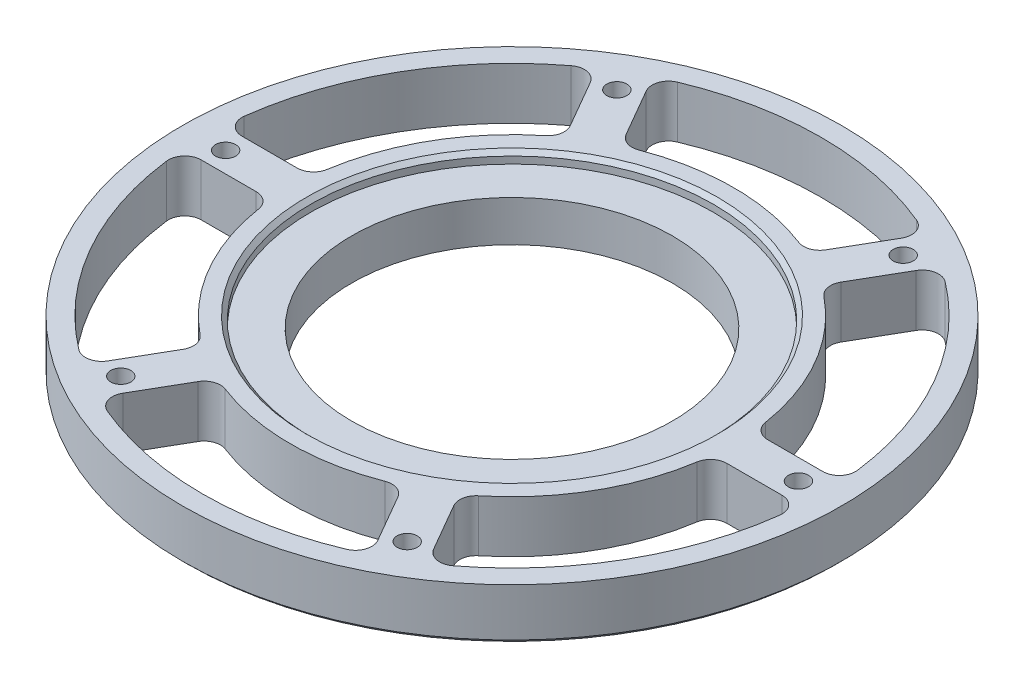
from build123d import *

# Parameters (mm, degrees)
F_10_0_1935_DIAMETER_HOLE1_D = 4.9149
CIRPATTERN3_COUNT            = 6
CUT_EXTRUDE1_DEPTH           = 115.6206569515286
FILLET1_R                    = 4
CIRPATTERN4_COUNT            = 6
FILLET1_OF_CIRPATTERN4_R     = 4
CHAMFER1_SIZE                = 1
CHAMFER2_SIZE                = 1


with BuildPart() as part:
    # Sketch2 → Revolve1 (revolve)
    with BuildSketch(Plane(origin=(0, 0, 0), x_dir=(0, 0, -1), z_dir=(1, 0, 0))):
        Polygon((-39.2125, -8.7e-16), (-80.55, -5.06e-15), (-80.55, 12.699999999999994), (-49.2125, 12.699999999999994), (-49.21250000000001, 9.999999999999998), (-39.21250000000001, 9.999999999999998), align=None)
    revolve(axis=Axis((0, -0.6350000000000053, 0), (0, 1, 0)))

    # #10 (0.1935) Diameter Hole1 (through all)
    with Locations(Plane(origin=(0, 12.699999999999994, 0), x_dir=(1, 0, 0), z_dir=(0, 1, 0))):
        with Locations((-35, 60.621778265)):
            f_10_0_1935_diameter_hole1 = Hole(F_10_0_1935_DIAMETER_HOLE1_D / 2)

    # CirPattern3: #10 (0.1935) Diameter Hole1 ×6 about axis
    cirpattern3_axis = Axis((0, -0.6350000000000053, 0), (0, 1, 0))
    for i in range(1, CIRPATTERN3_COUNT):
        add(f_10_0_1935_diameter_hole1.rotate(cirpattern3_axis, i * 360 / CIRPATTERN3_COUNT), mode=Mode.SUBTRACT)

    # Sketch8 → Cut-Extrude1 (cut, through all)
    with BuildSketch(Plane(origin=(0, 12.699999999999994, 0), x_dir=(1, 0, 0), z_dir=(0, 1, 0))):
        with BuildLine():
            Line((-33.36205552600358, 67.78477521597199), (-22.660589701137393, 49.249292691841845))
            ThreePointArc((-22.660589701137393, 49.249292691841845), (3.32e-15, 54.212500000000006), (22.660589701137393, 49.249292691841845))
            Line((22.660589701137393, 49.249292691841845), (33.36205552600358, 67.78477521597199))
            ThreePointArc((33.36205552600358, 67.78477521597199), (4.63e-15, 75.54999999999998), (-33.36205552600358, 67.78477521597199))
        make_face()
    cut_extrude1 = extrude(amount=-CUT_EXTRUDE1_DEPTH, mode=Mode.SUBTRACT)

    # Fillet1
    fillet1_edges = [part.edges().sort_by_distance(p)[0] for p in [
        (33.36205552600358, 6.349999999999996, -67.78477521597199),
        (22.660589701137397, 6.349999999999996, -49.249292691841845),
        (-33.36205552600357, 6.349999999999996, -67.78477521597199),
        (-22.660589701137393, 6.349999999999996, -49.249292691841845),
    ]]
    fillet(fillet1_edges, radius=FILLET1_R)

    # CirPattern4: Cut-Extrude1 ×6 about axis
    cirpattern4_axis = Axis((0, -0.6350000000000053, 0), (0, 1, 0))
    for i in range(1, CIRPATTERN4_COUNT):
        add(cut_extrude1.rotate(cirpattern4_axis, i * 360 / CIRPATTERN4_COUNT), mode=Mode.SUBTRACT)

    # Fillet1 of CirPattern4
    fillet1_of_cirpattern4_edges = [part.edges().sort_by_distance(p)[0] for p in [
        (-42.022309563847756, 6.349999999999996, -62.78477521597212),
        (-31.320843738981637, 6.349999999999996, -44.24929269184193),
        (-75.38436508985134, 6.349999999999996, -4.999999999999897),
        (-53.981433440119034, 6.349999999999996, -4.999999999999929),
        (-75.38436508985134, 6.349999999999996, 4.999999999999865),
        (-53.981433440119034, 6.349999999999996, 4.999999999999904),
        (-42.02230956384778, 6.349999999999996, 62.78477521597209),
        (-31.32084373898165, 6.349999999999996, 44.249292691841916),
        (-33.36205552600359, 6.349999999999996, 67.78477521597199),
        (-22.660589701137404, 6.349999999999996, 49.249292691841845),
        (33.362055526003566, 6.349999999999996, 67.78477521597199),
        (22.660589701137386, 6.349999999999996, 49.249292691841845),
        (42.02230956384773, 6.349999999999996, 62.78477521597213),
        (31.320843738981612, 6.349999999999996, 44.249292691841944),
        (75.38436508985134, 6.349999999999996, 4.999999999999925),
        (53.98143344011903, 6.349999999999996, 4.999999999999947),
        (75.38436508985134, 6.349999999999996, -4.99999999999989),
        (53.981433440119034, 6.349999999999996, -4.999999999999925),
        (42.022309563847756, 6.349999999999996, -62.784775215972104),
        (31.320843738981637, 6.349999999999996, -44.24929269184193),
    ]]
    fillet(fillet1_of_cirpattern4_edges, radius=FILLET1_OF_CIRPATTERN4_R)

    # Chamfer1
    chamfer1_edges = [part.edges().sort_by_distance(p)[0] for p in [
        (6.03e-15, 12.699999999999994, -49.2125),
    ]]
    chamfer(chamfer1_edges, length=CHAMFER1_SIZE)

    # Chamfer2
    chamfer2_edges = [part.edges().sort_by_distance(p)[0] for p in [
        (9.86e-15, -5.11e-15, -80.55),
    ]]
    chamfer(chamfer2_edges, length=CHAMFER2_SIZE)


solid = part.part
